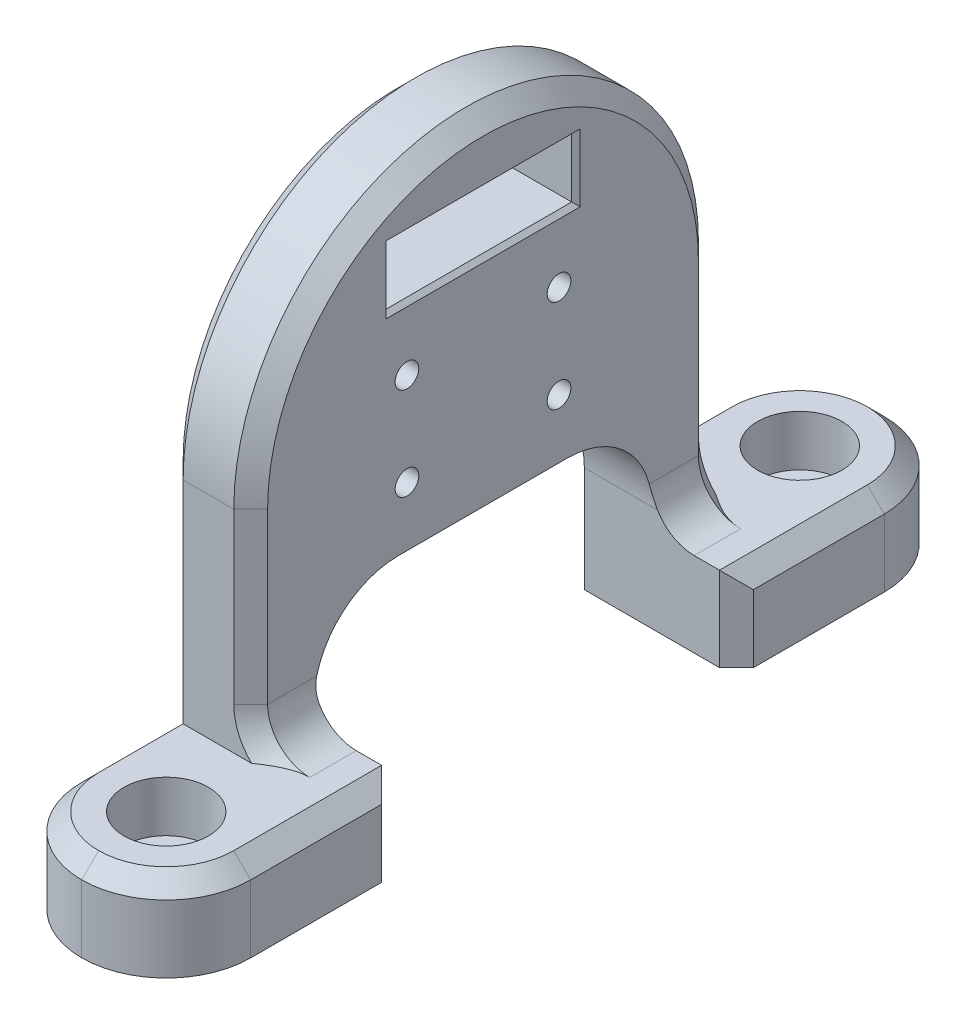
from build123d import *

# Parameters (mm, degrees)
EXTRUDE_1_DEPTH     = 10
SKETCH_2_R          = 1.4
CUT_EXTRUDE_1_DEPTH = 72.282887147
SKETCH_4_W          = 22
SKETCH_4_H          = 7
CUT_EXTRUDE_4_DEPTH = 10
CHAMFER_2_SIZE      = 0.5
SKETCH_5_W          = 10
SKETCH_5_H          = 55
CUT_EXTRUDE_5_DEPTH = 40
EXTRUDE_2_DEPTH     = 10
FILLET_1_R          = 10
SKETCH_7_R          = 5
CUT_EXTRUDE_6_DEPTH = 6
SKETCH_8_R          = 3.1
CUT_EXTRUDE_7_DEPTH = 6
SKETCH_9_W          = 40
SKETCH_9_H          = 45
CUT_EXTRUDE_8_DEPTH = 63.299678972
FILLET_2_R          = 10
FILLET_3_R          = 5
CHAMFER_3_SIZE      = 2


# Some blends are built 0.0001 mm under size
with BuildPart() as part:
    # 草图1 → 凸台-拉伸1 (new body)
    with BuildSketch(Plane(origin=(0, 0, 0), x_dir=(0, 0, -1), z_dir=(1, 0, 0))):
        with BuildLine():
            Line((-27.5, 0), (-27.5, -65))
            Line((-27.5, -65), (27.5, -65))
            Line((27.5, -65), (27.5, 0))
            ThreePointArc((27.5, 0), (0, 27.5), (-27.5, 0))
        make_face()
    extrude(amount=EXTRUDE_1_DEPTH)

    # 草图2 → 切除-拉伸1 (cut, through all)
    with BuildSketch(Plane(origin=(10, 0, 0), x_dir=(0, 0, -1), z_dir=(1, 0, 0))):
        with Locations((-9, 5.5)):
            Circle(SKETCH_2_R)
        with Locations((9, 5.5)):
            Circle(SKETCH_2_R)
        with Locations((9, -5.5)):
            Circle(SKETCH_2_R)
        with Locations((-9, -5.5)):
            Circle(SKETCH_2_R)
    extrude(amount=-CUT_EXTRUDE_1_DEPTH, mode=Mode.SUBTRACT)

    # 草图4 → 切除-拉伸4 (cut)
    with BuildSketch(Plane.ZY):
        with Locations((0, 16.5)):
            Rectangle(SKETCH_4_W, SKETCH_4_H)
    extrude(amount=-CUT_EXTRUDE_4_DEPTH, mode=Mode.SUBTRACT)

    # 倒角2
    chamfer_2_edges = [part.edges().sort_by_distance(p)[0] for p in [
        (10, 16.5, -11),
        (10, 20, 0),
        (10, 16.5, 11),
        (10, 13, 0),
        (0, 16.5, -11),
        (0, 13, 0),
        (0, 16.5, 11),
        (0, 20, 0),
    ]]
    chamfer(chamfer_2_edges, length=CHAMFER_2_SIZE)

    # 草图5 → 切除-拉伸5 (cut)
    with BuildSketch(Plane(origin=(0, -65, 0), x_dir=(-1, 0, 0), z_dir=(0, -1, 0))):
        with Locations((-5, 0)):
            Rectangle(SKETCH_5_W, SKETCH_5_H)
    extrude(amount=-CUT_EXTRUDE_5_DEPTH, mode=Mode.SUBTRACT)

    # 草图6 → 凸台-拉伸2 (add)
    with BuildSketch(Plane(origin=(0, -25, 0), x_dir=(-1, 0, 0), z_dir=(0, -1, 0))):
        Polygon((0, -27.5), (0, 27.5), (0, 47.5), (-20, 47.5), (-20, 27.5), (-20, -27.5), (-20, -47.5), (0, -47.5), align=None)
    extrude(amount=EXTRUDE_2_DEPTH)

    # 圆角1
    fillet_1_edges = [part.edges().sort_by_distance(p)[0] for p in [
        (0, -30, -47.5),
        (20, -30, -47.5),
        (0, -30, 47.5),
        (20, -30, 47.5),
    ]]
    fillet(fillet_1_edges, radius=FILLET_1_R - 0.0001)  # a hair under: the kernel refuses the full size

    # 草图7 → 切除-拉伸6 (cut)
    with BuildSketch(Plane(origin=(0, -25, 0), x_dir=(1, 0, 0), z_dir=(0, 1, 0))):
        with Locations(Location((10, 37.5, 0), (0, 0, 270))):
            Circle(SKETCH_7_R)
        with Locations(Location((10, -37.5, 0), (0, 0, 270))):
            Circle(SKETCH_7_R)
    extrude(amount=-CUT_EXTRUDE_6_DEPTH, mode=Mode.SUBTRACT)

    # 草图8 → 切除-拉伸7 (cut)
    with BuildSketch(Plane(origin=(0, -31, 0), x_dir=(1, 0, 0), z_dir=(0, 1, 0))):
        with Locations(Location((10, 37.5, 0), (0, 0, 270))):
            Circle(SKETCH_8_R)
        with Locations(Location((10, -37.5, 0), (0, 0, 270))):
            Circle(SKETCH_8_R)
    extrude(amount=-CUT_EXTRUDE_7_DEPTH, mode=Mode.SUBTRACT)

    # 草图9 → 切除-拉伸8 (cut, through all)
    with BuildSketch(Plane.ZY):
        with Locations((0, -35)):
            Rectangle(SKETCH_9_W, SKETCH_9_H)
    extrude(amount=-CUT_EXTRUDE_8_DEPTH, mode=Mode.SUBTRACT)

    # 圆角2
    fillet_2_edges = [part.edges().sort_by_distance(p)[0] for p in [
        (5, -12.5, 20),
        (5, -12.5, -20),
    ]]
    fillet(fillet_2_edges, radius=FILLET_2_R)

    # 圆角3
    fillet_3_edges = [part.edges().sort_by_distance(p)[0] for p in [
        (10, -25, -23.75),
        (10, -25, 23.75),
    ]]
    fillet(fillet_3_edges, radius=FILLET_3_R)

    # 倒角3
    # the kernel refuses this chamfer: 2 mm, written as the material it takes off along each edge
    with BuildSketch(Plane(origin=(0, -25, 37.5001), x_dir=(1, 0, 0), z_dir=(0, 0, -1)), Plane(origin=(0, -25, -27.5), x_dir=(1, 0, 0), z_dir=(0, 0, -1))) as chamfer_3_piece_1:
        Polygon((CHAMFER_3_SIZE, 0), (0, CHAMFER_3_SIZE), (0, 0), align=None)
    extrude(amount=10.0001, mode=Mode.SUBTRACT)
    with BuildSketch(Plane(origin=(20, -25, -37.5001), x_dir=(0, -1, 0), z_dir=(0, 0, 1))) as chamfer_3_piece_2:
        Polygon((CHAMFER_3_SIZE, 0), (0, -CHAMFER_3_SIZE), (0, 0), align=None)
    extrude(amount=22.643465976, mode=Mode.SUBTRACT)
    with BuildSketch(Plane(origin=(10.0001, -25, 37.5001), x_dir=(0, 0, 1), z_dir=(-1, 0, 0))) as chamfer_3_piece_3:
        Polygon((9.9999 - CHAMFER_3_SIZE, 0), (9.9999, -CHAMFER_3_SIZE), (9.9999, 0), align=None)
    revolve(axis=Axis((10.0001, -25, 37.5001), (0, 1, 0)), revolution_arc=90, mode=Mode.SUBTRACT)
    with BuildSketch(Plane(origin=(9.9999, -25, 37.5001), x_dir=(-1, 0, 0), z_dir=(0, 0, -1))) as chamfer_3_piece_4:
        Polygon((9.9999 - CHAMFER_3_SIZE, 0), (9.9999, -CHAMFER_3_SIZE), (9.9999, 0), align=None)
    revolve(axis=Axis((9.9999, -25, 37.5001), (0, 1, 0)), revolution_arc=90, mode=Mode.SUBTRACT)
    with BuildSketch(Plane(origin=(10.0001, -25, -37.5001), x_dir=(0, 0, -1), z_dir=(-1, 0, 0))) as chamfer_3_piece_5:
        Polygon((9.9999, CHAMFER_3_SIZE), (9.9999 - CHAMFER_3_SIZE, 0), (9.9999, 0), align=None)
    revolve(axis=Axis((10.0001, -25, -37.5001), (0, -1, 0)), revolution_arc=90, mode=Mode.SUBTRACT)
    with BuildSketch(Plane(origin=(9.9999, -25, -37.5001), x_dir=(-1, 0, 0), z_dir=(0, 0, 1))) as chamfer_3_piece_6:
        Polygon((9.9999, CHAMFER_3_SIZE), (9.9999 - CHAMFER_3_SIZE, 0), (9.9999, 0), align=None)
    revolve(axis=Axis((9.9999, -25, -37.5001), (0, -1, 0)), revolution_arc=90, mode=Mode.SUBTRACT)
    with BuildSketch(Plane(origin=(20, -25, 14.856634024), x_dir=(-1, 0, 0), z_dir=(0, 0, 1))) as chamfer_3_piece_7:
        Polygon((CHAMFER_3_SIZE, 0), (0, CHAMFER_3_SIZE), (0, 0), align=None)
    extrude(amount=22.643465976, mode=Mode.SUBTRACT)
    with BuildSketch(Plane(origin=(0, -40.143365976, 20), x_dir=(1, 0, 0), z_dir=(0, 1, 0)), Plane(origin=(0, -22.5, -20), x_dir=(1, 0, 0), z_dir=(0, -1, 0))) as chamfer_3_piece_8:
        Polygon((CHAMFER_3_SIZE, 0), (0, -CHAMFER_3_SIZE), (0, 0), align=None)
    extrude(amount=17.643365976, mode=Mode.SUBTRACT)
    with BuildSketch(Plane(origin=(20, -40.143365976, 20), x_dir=(0, 0, 1), z_dir=(0, 1, 0))) as chamfer_3_piece_9:
        Polygon((CHAMFER_3_SIZE, 0), (0, -CHAMFER_3_SIZE), (0, 0), align=None)
    extrude(amount=20.286731952, mode=Mode.SUBTRACT)
    with BuildSketch(Plane(origin=(20, -19.856634024, -20), x_dir=(-1, 0, 0), z_dir=(0, -1, 0))) as chamfer_3_piece_10:
        Polygon((CHAMFER_3_SIZE, 0), (0, CHAMFER_3_SIZE), (0, 0), align=None)
    extrude(amount=20.286731952, mode=Mode.SUBTRACT)
    with BuildSketch(Plane(origin=(0, -12.5, 10), x_dir=(1, 0, 0), z_dir=(0, 0, -1))) as chamfer_3_piece_11:
        Polygon((CHAMFER_3_SIZE, 0), (0, -CHAMFER_3_SIZE), (0, 0), align=None)
    extrude(amount=20, mode=Mode.SUBTRACT)
    with BuildSketch(Plane(origin=(0, -22.5, -10), x_dir=(0, 0, -1), z_dir=(0, -1, 0))) as chamfer_3_piece_12:
        Polygon((10 + CHAMFER_3_SIZE, 0), (10, CHAMFER_3_SIZE), (10, 0), align=None)
    revolve(axis=Axis((0, -22.5, -10), (1, 0, 0)), revolution_arc=90, mode=Mode.SUBTRACT)
    with BuildSketch(Plane(origin=(0, -22.5, 10), x_dir=(0, 1, 0), z_dir=(0, 0, -1))) as chamfer_3_piece_13:
        Polygon((10, CHAMFER_3_SIZE), (10 + CHAMFER_3_SIZE, 0), (10, 0), align=None)
    revolve(axis=Axis((0, -22.5, 10), (1, 0, 0)), revolution_arc=90, mode=Mode.SUBTRACT)
    with BuildSketch(Plane(origin=(10, -20, -27.5), x_dir=(-1, 0, 0), z_dir=(0, 1, 0)), Plane(origin=(10, 0, 27.5), x_dir=(-1, 0, 0), z_dir=(0, -1, 0))) as chamfer_3_piece_14:
        Polygon((CHAMFER_3_SIZE, 0), (0, CHAMFER_3_SIZE), (0, 0), align=None)
    extrude(amount=20, mode=Mode.SUBTRACT)
    with BuildSketch(Plane(origin=(15, -20, -27.5), x_dir=(0.8568283041143762, -0.5156018398614208, 0), z_dir=(0.5156018398614208, 0.8568283041143762, 0))) as chamfer_3_piece_15_section:
        Polygon((5 + CHAMFER_3_SIZE, 0), (5, -CHAMFER_3_SIZE), (5, 0), align=None)
    chamfer_3_piece_15 = revolve(axis=Axis((15, -20, -27.5), (0, 0, -1)), revolution_arc=148.962308712, mode=Mode.PRIVATE)
    chamfer_3_piece_15 = split(chamfer_3_piece_15, bisect_by=Plane(origin=(15, -25, -27.5), z_dir=(0, 1, 0)), keep=Keep.TOP, mode=Mode.PRIVATE)
    add(chamfer_3_piece_15, mode=Mode.SUBTRACT)
    with BuildSketch(Plane(origin=(15, -20, 27.5), x_dir=(0.8568283041143756, -0.5156018398614214, 0), z_dir=(0.5156018398614214, 0.8568283041143756, 0))) as chamfer_3_piece_16_section:
        Polygon((5 + CHAMFER_3_SIZE, 0), (5, CHAMFER_3_SIZE), (5, 0), align=None)
    chamfer_3_piece_16 = revolve(axis=Axis((15, -20, 27.5), (0, 0, -1)), revolution_arc=148.962308712, mode=Mode.PRIVATE)
    chamfer_3_piece_16 = split(chamfer_3_piece_16, bisect_by=Plane(origin=(15, -25, 27.5), z_dir=(0, 1, 0)), keep=Keep.TOP, mode=Mode.PRIVATE)
    add(chamfer_3_piece_16, mode=Mode.SUBTRACT)
    with BuildSketch(Plane(origin=(10, 0, 0), x_dir=(0, 0, -1), z_dir=(0, -1, 0))) as chamfer_3_piece_17:
        Polygon((27.5, -CHAMFER_3_SIZE), (27.5 - CHAMFER_3_SIZE, 0), (27.5, 0), align=None)
    revolve(axis=Axis((10, 0, 0), (1, 0, 0)), revolution_arc=180, mode=Mode.SUBTRACT)
    with BuildSketch(Plane(origin=(0, 0, 27.5), x_dir=(1, 0, 0), z_dir=(0, -1, 0)), Plane(origin=(0, -25, -27.5), x_dir=(1, 0, 0), z_dir=(0, 1, 0))) as chamfer_3_piece_18:
        Polygon((CHAMFER_3_SIZE, 0), (0, -CHAMFER_3_SIZE), (0, 0), align=None)
    extrude(amount=25, mode=Mode.SUBTRACT)
    with BuildSketch(Plane(origin=(0, 0, 0), x_dir=(0, 0, -1), z_dir=(0, -1, 0))) as chamfer_3_piece_19:
        Polygon((27.5, CHAMFER_3_SIZE), (27.5 - CHAMFER_3_SIZE, 0), (27.5, 0), align=None)
    revolve(axis=Axis((0, 0, 0), (1, 0, 0)), revolution_arc=180, mode=Mode.SUBTRACT)
    with BuildSketch(Plane(origin=(9.9999, -25, -47.5), x_dir=(0, -1, 0), z_dir=(1, 0, 0))) as chamfer_3_piece_20:
        Polygon((CHAMFER_3_SIZE, 0), (0, -CHAMFER_3_SIZE), (0, 0), align=None)
    extrude(amount=0.0002, mode=Mode.SUBTRACT)
    with BuildSketch(Plane(origin=(10.0001, -25, 47.5), x_dir=(0, 0, -1), z_dir=(-1, 0, 0))) as chamfer_3_piece_21:
        Polygon((CHAMFER_3_SIZE, 0), (0, CHAMFER_3_SIZE), (0, 0), align=None)
    extrude(amount=0.0002, mode=Mode.SUBTRACT)
    with BuildSketch(Plane(origin=(0, 0, 27.5), x_dir=(1, 0, 0), z_dir=(0, -1, 0))) as chamfer_3_piece_22a_section:
        Polygon((CHAMFER_3_SIZE, 0), (0, -CHAMFER_3_SIZE), (0, 0), align=None)
    chamfer_3_piece_22a = extrude(amount=30.143365976, mode=Mode.PRIVATE)
    chamfer_3_piece_22a = split(chamfer_3_piece_22a, bisect_by=Plane(origin=(0, -25, 27.5), z_dir=(0, -1, 0)), keep=Keep.TOP, mode=Mode.PRIVATE)
    with BuildSketch(Plane(origin=(0, -25, 37.5001), x_dir=(1, 0, 0), z_dir=(0, 0, -1))) as chamfer_3_piece_22b_section:
        Polygon((CHAMFER_3_SIZE, 0), (0, CHAMFER_3_SIZE), (0, 0), align=None)
    chamfer_3_piece_22b = extrude(amount=15.143465976, mode=Mode.PRIVATE)
    chamfer_3_piece_22b = split(chamfer_3_piece_22b, bisect_by=Plane(origin=(0, -25, 27.5), z_dir=(0, 0, -1)), keep=Keep.TOP, mode=Mode.PRIVATE)
    chamfer_3_piece_22 = chamfer_3_piece_22a & chamfer_3_piece_22b
    add(chamfer_3_piece_22, mode=Mode.SUBTRACT)
    with BuildSketch(Plane(origin=(0, -25, -22.356634024), x_dir=(1, 0, 0), z_dir=(0, 0, -1))) as chamfer_3_piece_23a_section:
        Polygon((CHAMFER_3_SIZE, 0), (0, CHAMFER_3_SIZE), (0, 0), align=None)
    chamfer_3_piece_23a = extrude(amount=15.143465976, mode=Mode.PRIVATE)
    chamfer_3_piece_23a = split(chamfer_3_piece_23a, bisect_by=Plane(origin=(0, -25, -27.5), z_dir=(0, 0, 1)), keep=Keep.TOP, mode=Mode.PRIVATE)
    with BuildSketch(Plane(origin=(0, -30.143365976, -27.5), x_dir=(1, 0, 0), z_dir=(0, 1, 0))) as chamfer_3_piece_23b_section:
        Polygon((CHAMFER_3_SIZE, 0), (0, -CHAMFER_3_SIZE), (0, 0), align=None)
    chamfer_3_piece_23b = extrude(amount=30.143365976, mode=Mode.PRIVATE)
    chamfer_3_piece_23b = split(chamfer_3_piece_23b, bisect_by=Plane(origin=(0, -25, -27.5), z_dir=(0, -1, 0)), keep=Keep.TOP, mode=Mode.PRIVATE)
    chamfer_3_piece_23 = chamfer_3_piece_23a & chamfer_3_piece_23b
    add(chamfer_3_piece_23, mode=Mode.SUBTRACT)


solid = part.part
